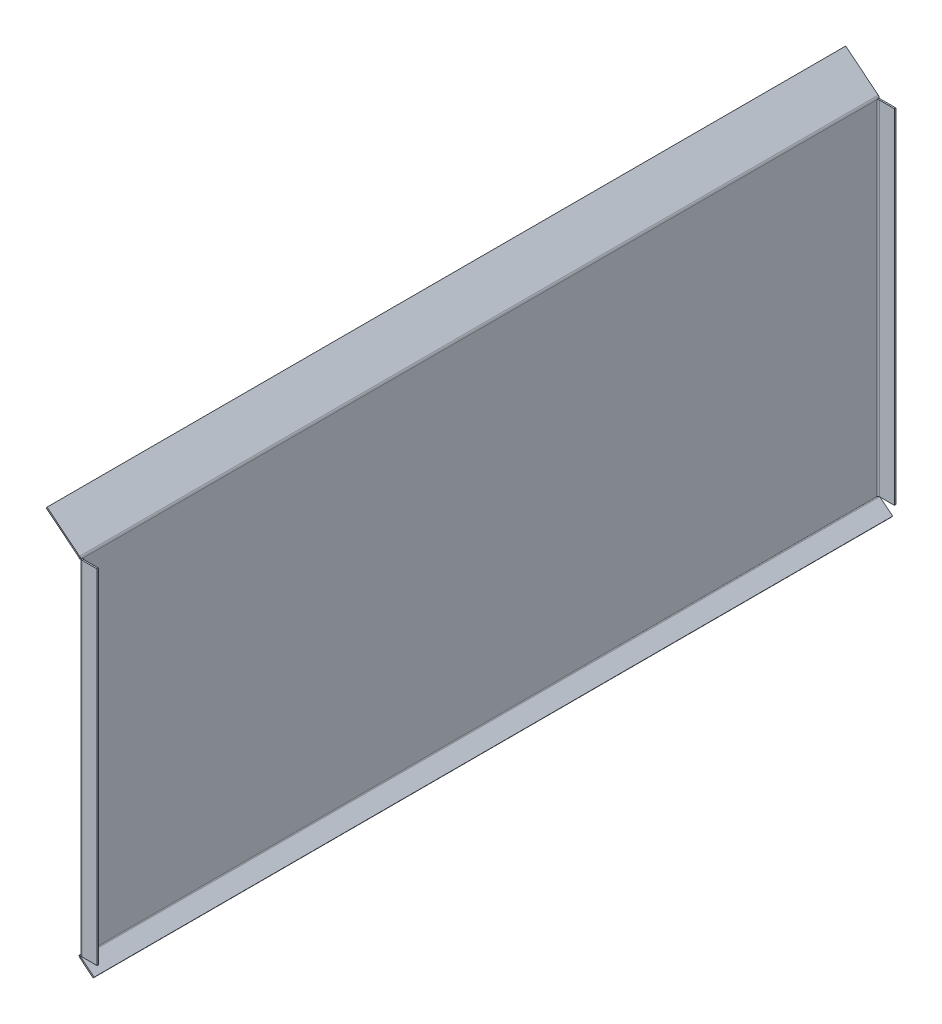
from build123d import *

# Parameters (mm, degrees)
SKETCH1_W                    = 2220
SKETCH1_H                    = 969
BASE_FLANGE1_DEPTH           = 4
EDGE_FLANGE1_START           = -788.522727273
EDGE_FLANGE1_DEPTH           = 2220
EDGE_FLANGE1_2_DEPTH         = 2220
EDGE_FLANGE2_START           = -788.522727273
EDGE_FLANGE2_DEPTH           = 2220
EDGE_FLANGE2_2_DEPTH         = 2220
EDGE_FLANGE3_STRIP_W         = 24
EDGE_FLANGE3_STRIP_H         = 4
EDGE_FLANGE3_STRIP_CUT_DEPTH = 954.890119211
EDGE_FLANGE3_DEPTH           = 954.890119211
EDGE_FLANGE4_STRIP_W         = 24
EDGE_FLANGE4_STRIP_H         = 4
EDGE_FLANGE4_STRIP_CUT_DEPTH = 954.890119211
EDGE_FLANGE4_DEPTH           = 954.890119211
CUT_EXTRUDE1_DEPTH           = 1665.285512579
LPATTERN1_COUNT              = 7
LPATTERN1_PITCH              = 300
CUT_EXTRUDE2_DEPTH           = 1665.285512579
CUT_EXTRUDE2_DEPTH_BACK      = 1665.285512579
SKETCH20_R                   = 7
CUT_EXTRUDE3_DEPTH           = 2327.408738422
LPATTERN2_COUNT              = 5
LPATTERN2_PITCH              = 190
CUT_EXTRUDE4_DEPTH           = 1704.883654617
LPATTERN3_COUNT              = 7
LPATTERN3_PITCH              = 300


# Read off the part's stored shape, not the designer's step: Edge-Flange1, Edge-Flange2
# Sheet-metal steps are written as plain solids
with BuildPart() as part:
    # Sketch1 → Base-Flange1 (new body)
    with BuildSketch(Plane(origin=(0, 0, 0), x_dir=(0, 0, -1), z_dir=(1, 0, 0))):
        with Locations((-321.477272727, 132.136363636)):
            Rectangle(SKETCH1_W, SKETCH1_H)
    extrude(amount=-BASE_FLANGE1_DEPTH)

    # Edge-Flange1 outline → Edge-Flange1 (cut)
    with BuildSketch(Plane.XY.offset(EDGE_FLANGE1_START)):
        with BuildLine():
            Line((-4, 616.636363636), (-2.965436872, 615.798590934))
            ThreePointArc((-2.965436872, 615.798590934), (-0.779317725, 613.025512017), (0, 609.581423242))
            Line((0, 609.581423242), (0, 616.636363636))
            Line((0, 616.636363636), (-4, 616.636363636))
        make_face()
    extrude(amount=EDGE_FLANGE1_DEPTH, mode=Mode.SUBTRACT)

    # Edge-Flange1 2 outline → Edge-Flange1 2 (add)
    with BuildSketch(Plane.XY.offset(EDGE_FLANGE1_START)):
        with BuildLine():
            Line((-4, 609.581423242), (-4, 616.636363636))
            Line((-4, 616.636363636), (-93.257515375, 688.91567443))
            Line((-93.257515375, 688.91567443), (-95.774796939, 685.807090584))
            Line((-95.774796939, 685.807090584), (-5.482718436, 612.690007088))
            ThreePointArc((-5.482718436, 612.690007088), (-4.389658863, 611.303467629), (-4, 609.581423242))
        make_face()
    extrude(amount=EDGE_FLANGE1_2_DEPTH)

    # Edge-Flange2 outline → Edge-Flange2 (cut)
    with BuildSketch(Plane.XY.offset(EDGE_FLANGE2_START)):
        with BuildLine():
            Line((0, -352.363636364), (-1.034563128, -351.525863661))
            ThreePointArc((-1.034563128, -351.525863661), (-3.220682275, -348.752784744), (-4, -345.308695969))
            Line((-4, -345.308695969), (-4, -352.363636364))
            Line((-4, -352.363636364), (0, -352.363636364))
        make_face()
    extrude(amount=EDGE_FLANGE2_DEPTH, mode=Mode.SUBTRACT)

    # Edge-Flange2 2 outline → Edge-Flange2 2 (add)
    with BuildSketch(Plane.XY.offset(EDGE_FLANGE2_START)):
        with BuildLine():
            Line((0, -345.308695969), (0, -352.363636364))
            Line((0, -352.363636364), (34.857298073, -380.590519783))
            Line((34.857298073, -380.590519783), (37.374579637, -377.481935938))
            Line((37.374579637, -377.481935938), (1.482718436, -348.417279815))
            ThreePointArc((1.482718436, -348.417279815), (0.389658863, -347.030740356), (0, -345.308695969))
        make_face()
    extrude(amount=EDGE_FLANGE2_2_DEPTH)

    # Edge-Flange3 strip (across the edge) → Edge-Flange3 strip cut (cut)
    with BuildSketch(Plane(origin=(0, 609.581423242, 1431.477272727), x_dir=(0, 0, -1), z_dir=(0, -1, 0))):
        with Locations((-4, -2)):
            Rectangle(EDGE_FLANGE3_STRIP_W, EDGE_FLANGE3_STRIP_H)
    extrude(amount=EDGE_FLANGE3_STRIP_CUT_DEPTH, mode=Mode.SUBTRACT)

    # Edge-Flange3 section (across the edge) → Edge-Flange3 (add)
    with BuildSketch(Plane(origin=(0, 609.581423242, 1431.477272727), x_dir=(0, 0, -1), z_dir=(0, -1, 0))):
        with BuildLine():
            Line((0, 4), (0, 46))
            Line((0, 46), (4, 46))
            Line((4, 46), (4, 4))
            ThreePointArc((4, 4), (5.171572875, 1.171572875), (8, 0))
            Line((8, 0), (8, -4))
            ThreePointArc((8, -4), (2.343145751, -1.656854249), (0, 4))
        make_face()
    extrude(amount=EDGE_FLANGE3_DEPTH)

    # Edge-Flange4 strip (across the edge) → Edge-Flange4 strip cut (cut)
    with BuildSketch(Plane(origin=(0, -345.308695969, -788.522727273), x_dir=(0, 0, 1), z_dir=(0, 1, 0))):
        with Locations((-4, -2)):
            Rectangle(EDGE_FLANGE4_STRIP_W, EDGE_FLANGE4_STRIP_H)
    extrude(amount=EDGE_FLANGE4_STRIP_CUT_DEPTH, mode=Mode.SUBTRACT)

    # Edge-Flange4 section (across the edge) → Edge-Flange4 (add)
    with BuildSketch(Plane(origin=(0, -345.308695969, -788.522727273), x_dir=(0, 0, 1), z_dir=(0, 1, 0))):
        with BuildLine():
            Line((0, 4), (0, 46))
            Line((0, 46), (4, 46))
            Line((4, 46), (4, 4))
            ThreePointArc((4, 4), (5.171572875, 1.171572875), (8, 0))
            Line((8, 0), (8, -4))
            ThreePointArc((8, -4), (2.343145751, -1.656854249), (0, 4))
        make_face()
    extrude(amount=EDGE_FLANGE4_DEPTH)

    # Sketch18 → Cut-Extrude1 (cut, symmetric)
    with BuildSketch(Plane(origin=(299.99651319, 370.464841108, 0), x_dir=(0.7771459614569677, -0.6293203910498413, 0), z_dir=(0.6293203910498414, 0.7771459614569678, 0))):
        with BuildLine():
            Line((-524.023383081, 943.522727273), (-524.023383081, 933.522727273))
            ThreePointArc((-524.023383081, 933.522727273), (-531.023383081, 926.522727273), (-538.023383081, 933.522727273))
            Line((-538.023383081, 933.522727273), (-538.023383081, 943.522727273))
            ThreePointArc((-538.023383081, 943.522727273), (-531.023383081, 950.522727273), (-524.023383081, 943.522727273))
        make_face()
    cut_extrude1 = extrude(amount=CUT_EXTRUDE1_DEPTH, both=True, mode=Mode.SUBTRACT)

    # LPattern1: Cut-Extrude1 ×7
    with Locations(*[(0, 0, i * LPATTERN1_PITCH) for i in range(1, LPATTERN1_COUNT)]):
        add(cut_extrude1, mode=Mode.SUBTRACT)

    # Sketch19 → Cut-Extrude2 (cut, two sides: drawn at the far end of the back side and taken through both)
    with BuildSketch(Plane(origin=(299.99651319, 370.464841108, 0), x_dir=(0.7771459614569677, -0.6293203910498413, 0), z_dir=(0.6293203910498414, 0.7771459614569678, 0)).offset(-CUT_EXTRUDE2_DEPTH_BACK)):
        with BuildLine():
            Line((484.914799236, -1336.477272727), (484.914799236, -1346.477272727))
            ThreePointArc((484.914799236, -1346.477272727), (477.914799236, -1353.477272727), (470.914799236, -1346.477272727))
            Line((470.914799236, -1346.477272727), (470.914799236, -1336.477272727))
            ThreePointArc((470.914799236, -1336.477272727), (477.914799236, -1329.477272727), (484.914799236, -1336.477272727))
        make_face()
    extrude(amount=CUT_EXTRUDE2_DEPTH + CUT_EXTRUDE2_DEPTH_BACK, mode=Mode.SUBTRACT)

    # Sketch20 → Cut-Extrude3 (cut, symmetric)
    with BuildSketch(Plane.XY.offset(1431.477272727)):
        with Locations((71, -246.525863661)):
            Circle(SKETCH20_R)
    cut_extrude3 = extrude(amount=CUT_EXTRUDE3_DEPTH, both=True, mode=Mode.SUBTRACT)

    # LPattern2: Cut-Extrude3 ×5
    with Locations(*[(0, -i * LPATTERN2_PITCH, 0) for i in range(1, LPATTERN2_COUNT)]):
        add(cut_extrude3, mode=Mode.SUBTRACT)

    # Sketch21 → Cut-Extrude4 (cut, symmetric)
    with BuildSketch(Plane(origin=(-169.814541183, -209.703494046, 0), x_dir=(0.7771459614569678, -0.6293203910498414, 0), z_dir=(0.6293203910498414, 0.7771459614569678, 0))):
        with BuildLine():
            Line((298.602583165, 943.522727273), (298.602583165, 933.522727273))
            ThreePointArc((298.602583165, 933.522727273), (291.602583165, 926.522727273), (284.602583165, 933.522727273))
            Line((284.602583165, 933.522727273), (284.602583165, 943.522727273))
            ThreePointArc((284.602583165, 943.522727273), (291.602583165, 950.522727273), (298.602583165, 943.522727273))
        make_face()
    cut_extrude4 = extrude(amount=CUT_EXTRUDE4_DEPTH, both=True, mode=Mode.SUBTRACT)

    # LPattern3: Cut-Extrude4 ×7
    with Locations(*[(0, 0, i * LPATTERN3_PITCH) for i in range(1, LPATTERN3_COUNT)]):
        add(cut_extrude4, mode=Mode.SUBTRACT)


solid = part.part
